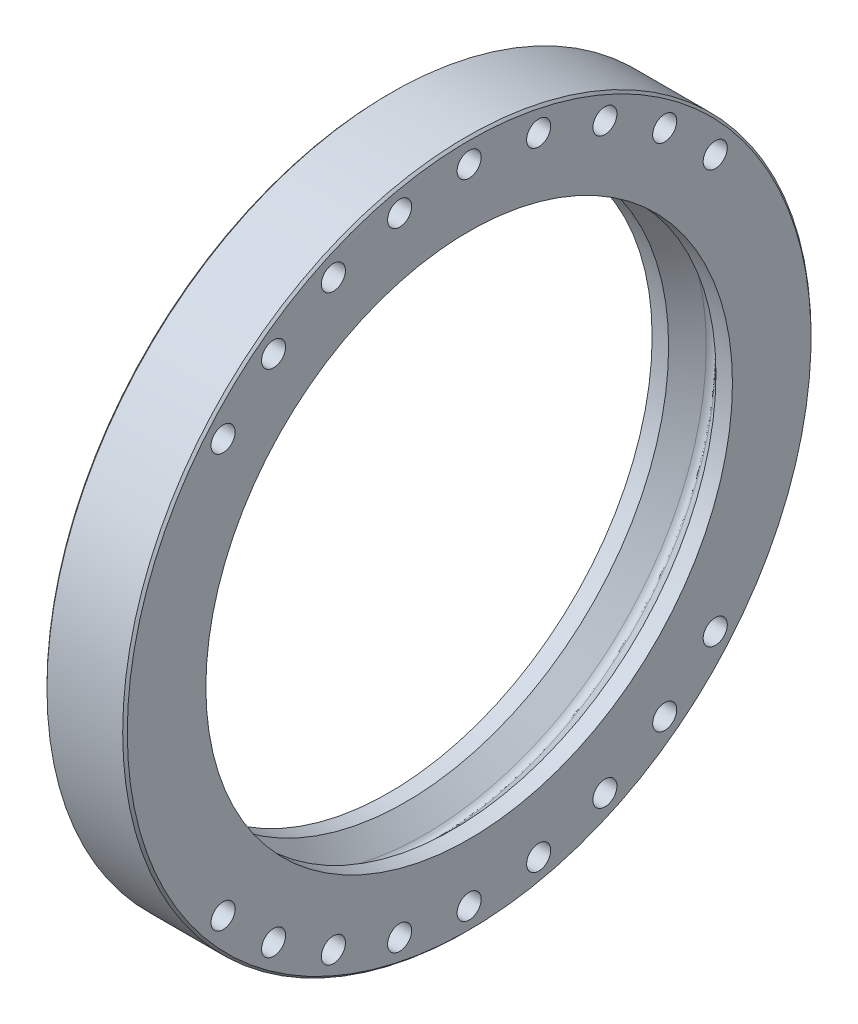
from build123d import *

# Parameters (mm, degrees)
CHAMFER1_SIZE                            = 1
FILLET1_SIZE                             = 3
CBORE_FOR_M10_HEX_HEAD_BOLT2_D           = 10.5
CBORE_FOR_M10_HEX_HEAD_BOLT2_CBORE_D     = 16
CBORE_FOR_M10_HEX_HEAD_BOLT2_CBORE_DEPTH = 10.8
CIRPATTERN1_COUNT                        = 5
CIRPATTERN1_ANGLE                        = 50
CIRPATTERN1_THE_OTHER_WAY_COUNT          = 5
CIRPATTERN1_THE_OTHER_WAY_ANGLE          = 50
MIRROR1_COPY_1_D                         = 10.5
MIRROR1_COPY_1_CBORE_D                   = 16
MIRROR1_COPY_1_CBORE_DEPTH               = 10.8
MIRROR1_COPY_2_D                         = 10.5
MIRROR1_COPY_2_CBORE_D                   = 16
MIRROR1_COPY_2_CBORE_DEPTH               = 10.8
MIRROR1_COPY_3_D                         = 10.5
MIRROR1_COPY_3_CBORE_D                   = 16
MIRROR1_COPY_3_CBORE_DEPTH               = 10.8
MIRROR1_COPY_4_D                         = 10.5
MIRROR1_COPY_4_CBORE_D                   = 16
MIRROR1_COPY_4_CBORE_DEPTH               = 10.8
MIRROR1_COPY_5_D                         = 10.5
MIRROR1_COPY_5_CBORE_D                   = 16
MIRROR1_COPY_5_CBORE_DEPTH               = 10.8
MIRROR1_COPY_6_D                         = 10.5
MIRROR1_COPY_6_CBORE_D                   = 16
MIRROR1_COPY_6_CBORE_DEPTH               = 10.8
MIRROR1_COPY_7_D                         = 10.5
MIRROR1_COPY_7_CBORE_D                   = 16
MIRROR1_COPY_7_CBORE_DEPTH               = 10.8
MIRROR1_COPY_8_D                         = 10.5
MIRROR1_COPY_8_CBORE_D                   = 16
MIRROR1_COPY_8_CBORE_DEPTH               = 10.8


with BuildPart() as part:
    # Sketch1 → Revolve1 (revolve)
    with BuildSketch(Plane.XY, mode=Mode.PRIVATE) as revolve1_sk:
        Polygon((17.5, 114.75), (17.5, 150), (-17.5, 150), (-17.5, 114.75), (-10.313708499, 114.75), (0, 125.063708499), (10.313708499, 114.75), align=None)
    revolve(revolve1_sk.sketch.rotate(Axis((0, 0, 0), (-1, 0, 0)), 90), axis=Axis((0, 0, 0), (-1, 0, 0)))

    # Chamfer1
    chamfer1_edges = [part.edges().sort_by_distance(p)[0] for p in [
        (-17.5, 0, 150),
        (17.5, 0, 150),
    ]]
    chamfer(chamfer1_edges, length=CHAMFER1_SIZE)

    # Fillet1
    # a fillet whose section is not a circle: 3 mm, written as the material it adds along each edge
    with BuildSketch(Plane(origin=(0, 0, 0), x_dir=(0, 0, -1), z_dir=(0, 1, 0))) as fillet1_piece_1:
        with BuildLine():
            add(Edge.make_bspline([(125.063708499 - FILLET1_SIZE * 0.707106781187, -FILLET1_SIZE * 0.707106781187), (125.063708499 - FILLET1_SIZE * 0.588172798365, -FILLET1_SIZE * 0.588172798365), (125.063708499 - FILLET1_SIZE * 0.469238815543, -FILLET1_SIZE * 0.469238815543), (125.063708499 - FILLET1_SIZE * 0.257800623859, -FILLET1_SIZE * 0.156412938514), (125.063708499 - FILLET1_SIZE * 0.257800623859, FILLET1_SIZE * 0.156412938514), (125.063708499 - FILLET1_SIZE * 0.469238815543, FILLET1_SIZE * 0.469238815543), (125.063708499 - FILLET1_SIZE * 0.588172798365, FILLET1_SIZE * 0.588172798365), (125.063708499 - FILLET1_SIZE * 0.707106781187, FILLET1_SIZE * 0.707106781187)], knots=[0, 0, 0, 0, 0, 0, 0.5, 0.5, 1, 1, 1, 1, 1, 1], degree=5))
            Line((125.063708499 - FILLET1_SIZE * 0.707106781187, FILLET1_SIZE * 0.707106781187), (125.063708499, 0))
            Line((125.063708499, 0), (125.063708499 - FILLET1_SIZE * 0.707106781187, -FILLET1_SIZE * 0.707106781187))
        make_face()
    revolve(axis=Axis((0, 0, 0), (-1, 0, 0)))

    # CBORE for M10 Hex Head Bolt2 (through all)
    with Locations(Plane(origin=(-17.5, 140, 0), x_dir=(0, 0, -1), z_dir=(-1, 0, 0))):
        with Locations((0, 0)):
            cbore_for_m10_hex_head_bolt2 = CounterBoreHole(CBORE_FOR_M10_HEX_HEAD_BOLT2_D / 2, CBORE_FOR_M10_HEX_HEAD_BOLT2_CBORE_D / 2, CBORE_FOR_M10_HEX_HEAD_BOLT2_CBORE_DEPTH)

    # CirPattern1: CBORE for M10 Hex Head Bolt2 ×5 about axis
    cirpattern1_axis = Axis((0, 0, 0), (1, 0, 0))
    for i in range(1, CIRPATTERN1_COUNT):
        add(cbore_for_m10_hex_head_bolt2.rotate(cirpattern1_axis, i * CIRPATTERN1_ANGLE / (CIRPATTERN1_COUNT - 1)), mode=Mode.SUBTRACT)

    # CirPattern1 the other way: CBORE for M10 Hex Head Bolt2 ×5 about axis
    cirpattern1_the_other_way_axis = Axis((0, 0, 0), (-1, 0, 0))
    for i in range(1, CIRPATTERN1_THE_OTHER_WAY_COUNT):
        add(cbore_for_m10_hex_head_bolt2.rotate(cirpattern1_the_other_way_axis, i * CIRPATTERN1_THE_OTHER_WAY_ANGLE / (CIRPATTERN1_THE_OTHER_WAY_COUNT - 1)), mode=Mode.SUBTRACT)

    # Mirror1: CBORE for M10 Hex Head Bolt2 across plane
    add(cbore_for_m10_hex_head_bolt2.mirror(Plane.ZX), mode=Mode.SUBTRACT)

    # Mirror1 copy 1 (through all)
    with Locations(Plane(origin=(-17.5, -136.681440997, 30.301545951), x_dir=(0, -0.21643961393810338, -0.9762960071199333), z_dir=(-1, 0, 0))):
        with Locations((0, 0)):
            CounterBoreHole(MIRROR1_COPY_1_D / 2, MIRROR1_COPY_1_CBORE_D / 2, MIRROR1_COPY_1_CBORE_DEPTH)

    # Mirror1 copy 2 (through all)
    with Locations(Plane(origin=(-17.5, -126.883090185, 59.166556644), x_dir=(0, -0.42261826174070033, -0.9063077870366495), z_dir=(-1, 0, 0))):
        with Locations((0, 0)):
            CounterBoreHole(MIRROR1_COPY_2_D / 2, MIRROR1_COPY_2_CBORE_D / 2, MIRROR1_COPY_2_CBORE_DEPTH)

    # Mirror1 copy 3 (through all)
    with Locations(Plane(origin=(-17.5, -111.069467641, 85.226600061), x_dir=(0, -0.6087614290087218, -0.7933533402912343), z_dir=(-1, 0, 0))):
        with Locations((0, 0)):
            CounterBoreHole(MIRROR1_COPY_3_D / 2, MIRROR1_COPY_3_CBORE_D / 2, MIRROR1_COPY_3_CBORE_DEPTH)

    # Mirror1 copy 4 (through all)
    with Locations(Plane(origin=(-17.5, -89.990265356, 107.246222037), x_dir=(0, -0.7660444431189793, -0.6427876096865378), z_dir=(-1, 0, 0))):
        with Locations((0, 0)):
            CounterBoreHole(MIRROR1_COPY_4_D / 2, MIRROR1_COPY_4_CBORE_D / 2, MIRROR1_COPY_4_CBORE_DEPTH)

    # Mirror1 copy 5 (through all)
    with Locations(Plane(origin=(-17.5, -136.681440997, -30.301545951), x_dir=(0, 0.21643961393810338, -0.9762960071199333), z_dir=(-1, 0, 0))):
        with Locations((0, 0)):
            CounterBoreHole(MIRROR1_COPY_5_D / 2, MIRROR1_COPY_5_CBORE_D / 2, MIRROR1_COPY_5_CBORE_DEPTH)

    # Mirror1 copy 6 (through all)
    with Locations(Plane(origin=(-17.5, -126.883090185, -59.166556644), x_dir=(0, 0.42261826174070033, -0.9063077870366495), z_dir=(-1, 0, 0))):
        with Locations((0, 0)):
            CounterBoreHole(MIRROR1_COPY_6_D / 2, MIRROR1_COPY_6_CBORE_D / 2, MIRROR1_COPY_6_CBORE_DEPTH)

    # Mirror1 copy 7 (through all)
    with Locations(Plane(origin=(-17.5, -111.069467641, -85.226600061), x_dir=(0, 0.6087614290087218, -0.7933533402912343), z_dir=(-1, 0, 0))):
        with Locations((0, 0)):
            CounterBoreHole(MIRROR1_COPY_7_D / 2, MIRROR1_COPY_7_CBORE_D / 2, MIRROR1_COPY_7_CBORE_DEPTH)

    # Mirror1 copy 8 (through all)
    with Locations(Plane(origin=(-17.5, -89.990265356, -107.246222037), x_dir=(0, 0.7660444431189793, -0.6427876096865378), z_dir=(-1, 0, 0))):
        with Locations((0, 0)):
            CounterBoreHole(MIRROR1_COPY_8_D / 2, MIRROR1_COPY_8_CBORE_D / 2, MIRROR1_COPY_8_CBORE_DEPTH)


solid = part.part
